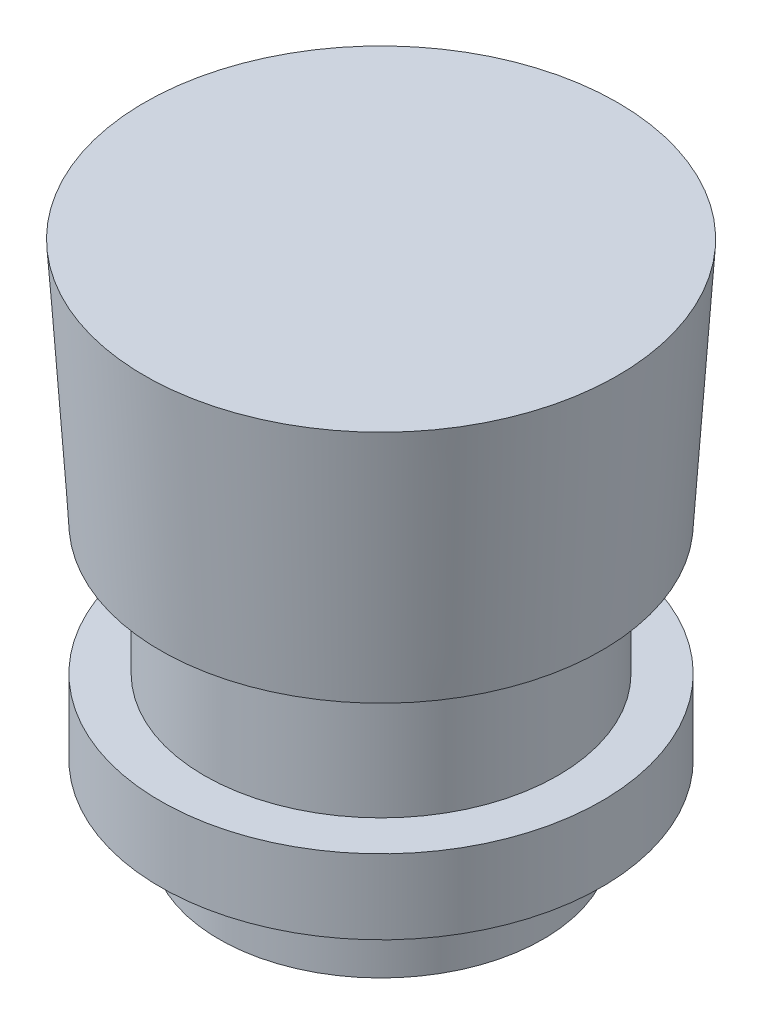
from build123d import *


with BuildPart() as part:
    # Sketch1 → Revolve1 (revolve)
    with BuildSketch(Plane.XY):
        Polygon((0, 17.907), (-16.129, 17.907), (-15.049, 1.143), (-12.049, 1.143), (-12.049, -7.747), (-15.049, -7.747), (-15.049, -12.827), (-11.049, -12.827), (-11.049, -17.907), (0, -17.907), (0, 0), align=None)
    revolve(axis=Axis((0, 0, 0), (0, 1, 0)))


solid = part.part
